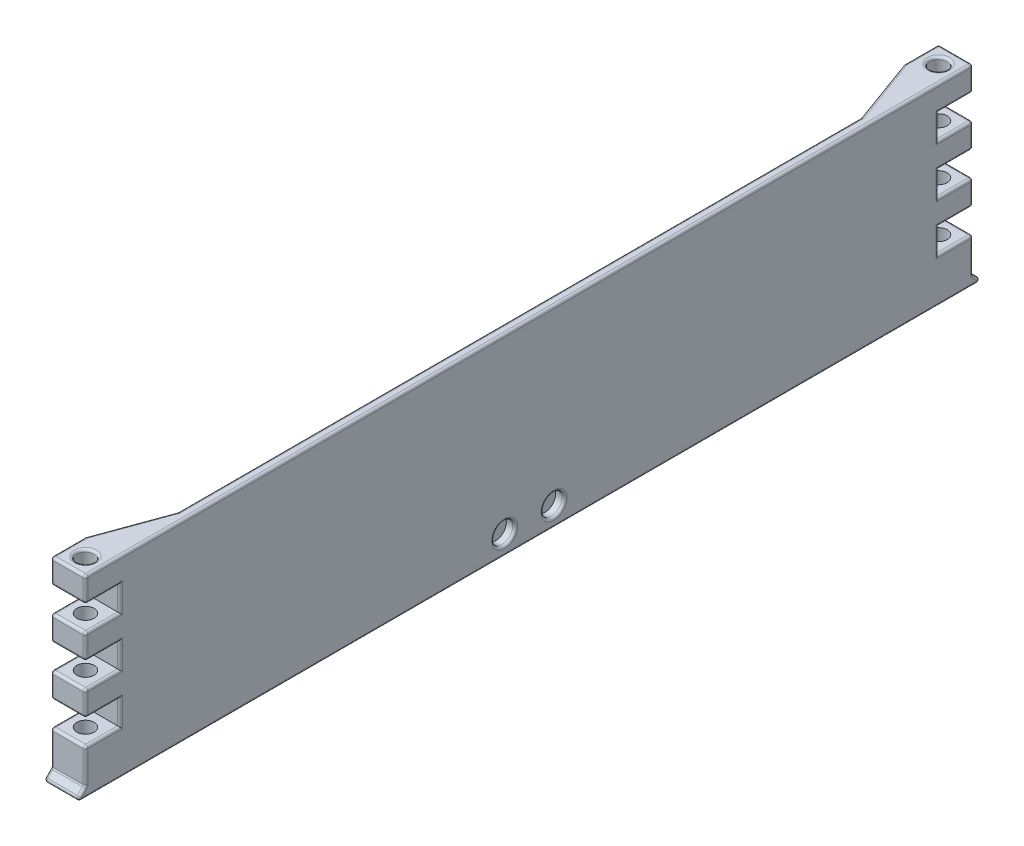
from build123d import *

# Parameters (mm, degrees)
SKETCH1_R               = 2.15
BOSS_EXTRUDE1_DEPTH     = 7
SKETCH1_3_R             = 2.15
BOSS_EXTRUDE2_DEPTH     = 5.2
CUT_EXTRUDE3_DEPTH      = 62.473571557
CUT_EXTRUDE3_DEPTH_BACK = 62.473571557
SKETCH7_R               = 1.75
CUT_EXTRUDE4_DEPTH      = 62.473571557
CUT_EXTRUDE4_DEPTH_BACK = 6
SKETCH7_3_R             = 1.75
CUT_EXTRUDE5_DEPTH      = 62.473571557
FILLET1_R               = 0.5


with BuildPart() as part:
    # Sketch1 → Boss-Extrude1 (new body)
    with BuildSketch(Plane(origin=(0, 0, 0), x_dir=(0, 0, -1), z_dir=(1, 0, 0))):
        Polygon((-47, -19.5), (-45, -19.5), (45, -19.5), (45, 19.5), (-38, 19.5), (-45, 19.5), (-45, 14.5), (-38, 14.5), (-38, 9.5), (-45, 9.5), (-45, 4.5), (-38, 4.5), (-38, -0.5), (-45, -0.5), (-45, -5.5), (-38, -5.5), (-38, -10.5), (-45, -10.5), (-45, -17.5), align=None)
        with Locations((40, -15.5)):
            Circle(SKETCH1_R, mode=Mode.SUBTRACT)
    extrude(amount=BOSS_EXTRUDE1_DEPTH)

    # Sketch1<3> → Boss-Extrude2 (add)
    with BuildSketch(Plane(origin=(0, 0, 0), x_dir=(0, 0, -1), z_dir=(1, 0, 0))):
        with Locations((40, -15.5)):
            Circle(SKETCH1_3_R)
    extrude(amount=BOSS_EXTRUDE2_DEPTH)

    # Sketch7 → Cut-Extrude3 (cut, two sides: drawn at the far end of the back side and taken through both)
    with BuildSketch(Plane.XZ.offset(19.5).offset(-CUT_EXTRUDE3_DEPTH_BACK)):
        with Locations((3.5, 41.5)):
            Circle(SKETCH7_R)
    extrude(amount=CUT_EXTRUDE3_DEPTH + CUT_EXTRUDE3_DEPTH_BACK, mode=Mode.SUBTRACT)

    # Sketch7<3> → Cut-Extrude4 (cut, two sides: drawn at the far end of the back side and taken through both)
    with BuildSketch(Plane.XZ.offset(19.5).offset(-CUT_EXTRUDE4_DEPTH_BACK)):
        Polygon((0.675, 43.13101451), (0.675, 39.86898549), (3.5, 38.237970979), (6.325, 39.86898549), (6.325, 43.13101451), (3.5, 44.762029021), align=None)
        with Locations((3.5, 41.5)):
            Circle(SKETCH7_3_R, mode=Mode.SUBTRACT)
    extrude(amount=CUT_EXTRUDE4_DEPTH + CUT_EXTRUDE4_DEPTH_BACK, mode=Mode.SUBTRACT)

    # Sketch8 → Cut-Extrude5 (cut, through all)
    with BuildSketch(Plane(origin=(0, 19.5, 0), x_dir=(1, 0, 0), z_dir=(0, 1, 0))):
        Polygon((0, -38), (5, -24.262612903), (5, 45), (0, 45), align=None)
    extrude(amount=-CUT_EXTRUDE5_DEPTH, mode=Mode.SUBTRACT)

    # Mirror2: part across plane


with BuildPart() as part_1:
    add(part.part)
    add(part.part.mirror(Plane(origin=(7, 0, -45), x_dir=(1, 0, 0), z_dir=(0, 0, 1))))

    # Fillet1
    fillet1_edges = [part_1.edges().sort_by_distance(p)[0] for p in [
        (2.5, -19.5, 31.131306451),
        (2.5, -19.5, -121.131306451),
        (0, -18.5, -136),
        (0, -18.5, 46),
        (3.5, -17.5, -135),
        (3.5, -10.5, -135),
        (0, -14, -135),
        (3.5, -5.5, -135),
        (3.5, -0.5, -135),
        (0, -3, -135),
        (3.5, 4.5, -135),
        (3.5, 9.5, -135),
        (0, 7, -135),
        (3.5, 14.5, -135),
        (0, 17, -135),
        (7, -10.5, 41.5),
        (7, -8, 38),
        (7, -5.5, 41.5),
        (7, -0.5, 41.5),
        (7, 2, 38),
        (7, 4.5, 41.5),
        (7, 9.5, 41.5),
        (7, 12, 38),
        (7, 14.5, 41.5),
        (7, 17, -135),
        (7, 14.5, -131.5),
        (7, 12, -128),
        (7, 9.5, -131.5),
        (7, 7, -135),
        (7, 4.5, -131.5),
        (7, 2, -128),
        (7, -0.5, -131.5),
        (7, -3, -135),
        (7, -5.5, -131.5),
        (7, -8, -128),
        (7, -10.5, -131.5),
        (7, -14, -135),
        (7, -18.5, -136),
        (7, -19.5, -45),
        (7, -18.5, 46),
        (3.5, -10.5, 45),
        (7, -14, 45),
        (3.5, -17.5, 45),
        (0, -14, 45),
        (3.5, -0.5, 45),
        (7, -3, 45),
        (3.5, -5.5, 45),
        (0, -3, 45),
        (3.5, 9.5, 45),
        (7, 7, 45),
        (3.5, 4.5, 45),
        (0, 7, 45),
        (7, 17, 45),
        (3.5, 14.5, 45),
        (0, 17, 45),
        (1.75, 19.5, -131.5),
        (1.75, 19.5, 41.5),
        (2.5, 19.5, -121.131306451),
        (0, 19.5, -131.5),
        (3.5, 19.5, -135),
        (7, 19.5, -45),
        (3.5, 19.5, 45),
        (0, 19.5, 41.5),
        (2.5, 19.5, 31.131306451),
        (0, -19.5, 42.5),
        (0, -19.5, -132.5),
        (0, 14.5, 41.5),
        (0, 9.5, 41.5),
        (0, 4.5, 41.5),
        (0, -0.5, 41.5),
        (0, -5.5, 41.5),
        (0, -10.5, 41.5),
        (0, -10.5, -131.5),
        (0, -5.5, -131.5),
        (0, -0.5, -131.5),
        (0, 4.5, -131.5),
        (0, 9.5, -131.5),
        (0, 14.5, -131.5),
        (3.5, -19.5, 47),
        (3.5, -19.5, -137),
        (7, -15.5, -52.15),
        (7, -15.5, -37.85),
        (5, 19.5, -45),
        (5, -19.5, -45),
    ]]
    fillet(fillet1_edges, radius=FILLET1_R)


solid = part_1.part
